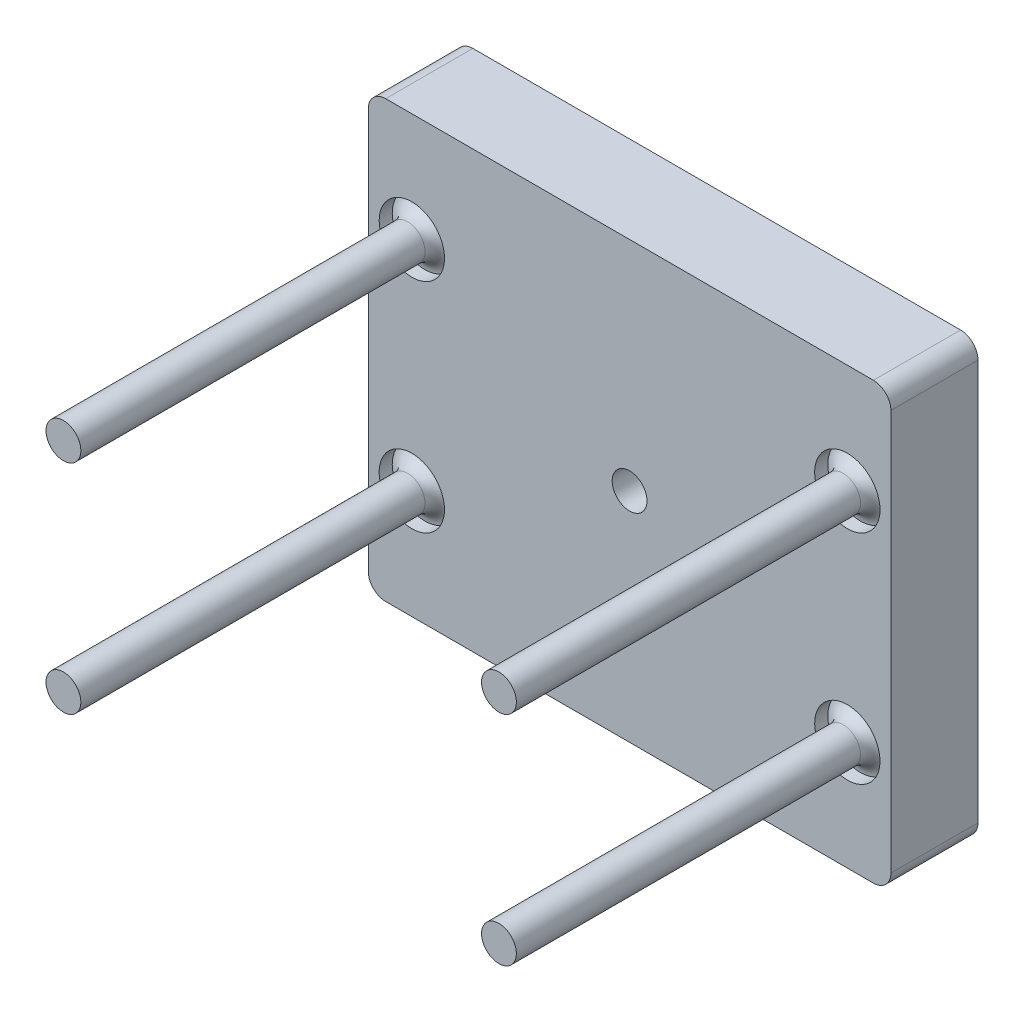
from build123d import *

# Parameters (mm, degrees)
ESQUISSE1_W             = 60
ESQUISSE1_H             = 50
BOSS_EXTRU_1_DEPTH      = 5
ESQUISSE2_R             = 2
BOSS_EXTRU_2_DEPTH      = 40
ESQUISSE3_R             = 2
ENL_V_MAT_EXTRU_1_DEPTH = 88.749643874
CONG_1_R                = 2
CONG_2_R                = 2
ENL_V_START             = -1.5
ESQUISSE4_R             = 3.75
ESQUISSE4_R_2           = 2
ENL_V_MAT_EXTRU_5_DEPTH = 1.5
CONG_5_R                = 2
CONG_6_R                = 2
CONG_7_R                = 2
CONG_8_R                = 2


with BuildPart() as part:
    # Esquisse1 → Boss.-Extru.1 (new, symmetric)
    with BuildSketch(Plane.XY):
        with Locations((30, -25)):
            Rectangle(ESQUISSE1_W, ESQUISSE1_H)
    extrude(amount=BOSS_EXTRU_1_DEPTH, both=True)

    # Esquisse2 → Boss.-Extru.2 (add)
    with BuildSketch(Plane.XY.offset(5)):
        with Locations((5, -12.5)):
            Circle(ESQUISSE2_R)
        with Locations(Location((5, -37.5, 0), (0, 0, 180))):
            Circle(ESQUISSE2_R)
        with Locations((55, -37.5)):
            Circle(ESQUISSE2_R)
        with Locations(Location((55, -12.5, 0), (0, 0, 180))):
            Circle(ESQUISSE2_R)
    extrude(amount=BOSS_EXTRU_2_DEPTH)

    # Esquisse3 → Enlèv. mat.-Extru.1 (cut, through all)
    with BuildSketch(Plane.XY.offset(5)):
        with Locations((30, -25)):
            Circle(ESQUISSE3_R)
    extrude(amount=-ENL_V_MAT_EXTRU_1_DEPTH, mode=Mode.SUBTRACT)

    # Congé1
    cong_1_edges = [part.edges().sort_by_distance(p)[0] for p in [
        (0, 0, 0),
    ]]
    fillet(cong_1_edges, radius=CONG_1_R)

    # Congé2
    cong_2_edges = [part.edges().sort_by_distance(p)[0] for p in [
        (60, 0, 0),
        (60, -50, 0),
        (0, -50, 0),
    ]]
    fillet(cong_2_edges, radius=CONG_2_R)

    # Esquisse4 → Enlèv. mat.-Extru.5 (cut)
    # profile 1 of 4: a face of its own
    with BuildSketch(Plane.XY.offset(5).offset(ENL_V_START)):
        with Locations((5, -37.5)):
            Circle(ESQUISSE4_R)
        with Locations(Location((5, -37.5, 0), (0, 0, 180))):
            Circle(ESQUISSE4_R_2, mode=Mode.SUBTRACT)
    # profile 2 of 4: a face of its own
    with BuildSketch(Plane.XY.offset(5).offset(ENL_V_START)):
        with Locations(Location((5, -12.5, 0), (0, 0, 180))):
            Circle(ESQUISSE4_R)
        with Locations((5, -12.5)):
            Circle(ESQUISSE4_R_2, mode=Mode.SUBTRACT)
    # profile 3 of 4: a face of its own
    with BuildSketch(Plane.XY.offset(5).offset(ENL_V_START)):
        with Locations((55, -12.5)):
            Circle(ESQUISSE4_R)
        with Locations(Location((55, -12.5, 0), (0, 0, 180))):
            Circle(ESQUISSE4_R_2, mode=Mode.SUBTRACT)
    # profile 4 of 4: a face of its own
    with BuildSketch(Plane.XY.offset(5).offset(ENL_V_START)):
        with Locations(Location((55, -37.5, 0), (0, 0, 180))):
            Circle(ESQUISSE4_R)
        with Locations((55, -37.5)):
            Circle(ESQUISSE4_R_2, mode=Mode.SUBTRACT)
    extrude(amount=ENL_V_MAT_EXTRU_5_DEPTH, mode=Mode.SUBTRACT)

    # Congé5
    # the kernel refuses this fillet: 2 mm, written as the material it adds along each edge
    with BuildSketch(Plane(origin=(55, -37.5, 3.5), x_dir=(1, 0, 0), z_dir=(0, -1, 0))) as cong_5_piece_1:
        with BuildLine():
            CenterArc((4, 1.984313483), CONG_5_R, 180, 82.819244219)
            Line((2, 1.984313483), (1.96, 1.984313483))
            Line((1.96, 1.984313483), (1.96, 0))
            Line((1.96, 0), (2, -0.04))
            ThreePointArc((2, -0.04), (2.875, -0.04), (3.745, -0.03968627))
            Line((3.745, -0.03968627), (3.75, 0))
        make_face()
    revolve(axis=Axis((55, -37.5, 3.5), (0, 0, 1)))

    # Congé6
    # the kernel refuses this fillet: 2 mm, written as the material it adds along each edge
    with BuildSketch(Plane(origin=(55, -12.5, 3.5), x_dir=(-1, 0, 0), z_dir=(0, 1, 0))) as cong_6_piece_1:
        with BuildLine():
            CenterArc((4, 1.984313483), CONG_6_R, 180, 82.819244219)
            Line((2, 1.984313483), (1.96, 1.984313483))
            Line((1.96, 1.984313483), (1.96, 0))
            Line((1.96, 0), (2, -0.04))
            ThreePointArc((2, -0.04), (2.875, -0.04), (3.745, -0.03968627))
            Line((3.745, -0.03968627), (3.75, 0))
        make_face()
    revolve(axis=Axis((55, -12.5, 3.5), (0, 0, 1)))

    # Congé7
    # the kernel refuses this fillet: 2 mm, written as the material it adds along each edge
    with BuildSketch(Plane(origin=(5, -12.5, 3.5), x_dir=(1, 0, 0), z_dir=(0, -1, 0))) as cong_7_piece_1:
        with BuildLine():
            CenterArc((4, 1.984313483), CONG_7_R, 180, 82.819244219)
            Line((2, 1.984313483), (1.96, 1.984313483))
            Line((1.96, 1.984313483), (1.96, 0))
            Line((1.96, 0), (2, -0.04))
            ThreePointArc((2, -0.04), (2.875, -0.04), (3.745, -0.03968627))
            Line((3.745, -0.03968627), (3.75, 0))
        make_face()
    revolve(axis=Axis((5, -12.5, 3.5), (0, 0, 1)))

    # Congé8
    # the kernel refuses this fillet: 2 mm, written as the material it adds along each edge
    with BuildSketch(Plane(origin=(5, -37.5, 3.5), x_dir=(-1, 0, 0), z_dir=(0, 1, 0))) as cong_8_piece_1:
        with BuildLine():
            CenterArc((4, 1.984313483), CONG_8_R, 180, 82.819244219)
            Line((2, 1.984313483), (1.96, 1.984313483))
            Line((1.96, 1.984313483), (1.96, 0))
            Line((1.96, 0), (2, -0.04))
            ThreePointArc((2, -0.04), (2.875, -0.04), (3.745, -0.03968627))
            Line((3.745, -0.03968627), (3.75, 0))
        make_face()
    revolve(axis=Axis((5, -37.5, 3.5), (0, 0, 1)))


solid = part.part
